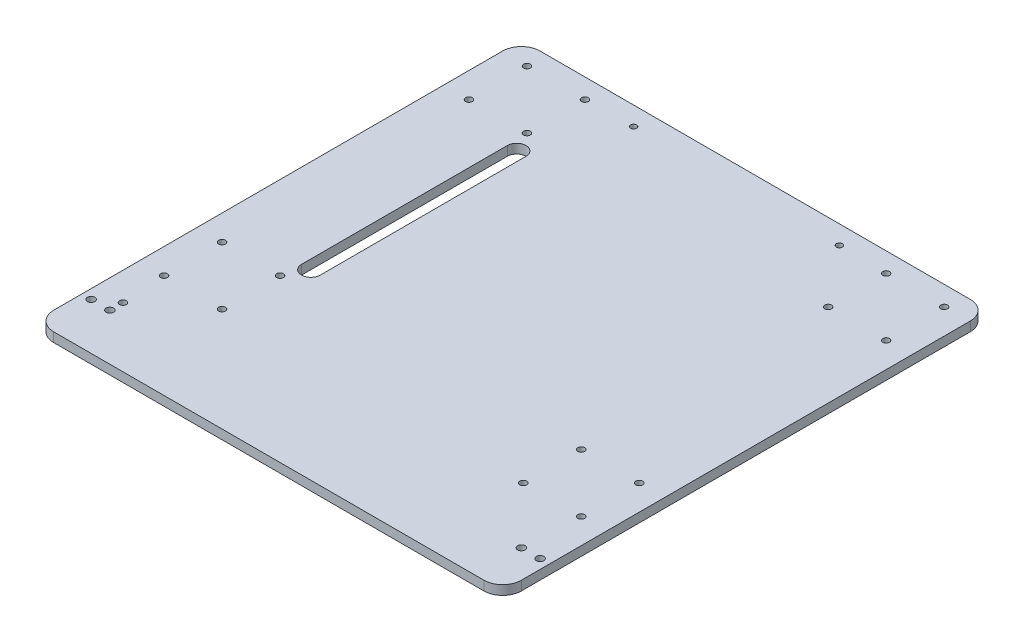
from build123d import *

# Parameters (mm, degrees)
SKETCH_1_W      = 250
SKETCH_1_H      = 260
SKETCH_1_R      = 1.8
SKETCH_1_R_2    = 2
SKETCH_1_R_3    = 1.6
EXTRUDE_1_DEPTH = 5
FILLET_2_R      = 10


with BuildPart() as part:
    # 草图1 → 凸台-拉伸1 (new body)
    with BuildSketch(Plane(origin=(0, 0, 0), x_dir=(1, 0, 0), z_dir=(0, 1, 0))):
        Rectangle(SKETCH_1_W, SKETCH_1_H)
        with Locations((-111.5, 119.5)):
            Circle(SKETCH_1_R, mode=Mode.SUBTRACT)
        with Locations((-80.5, 119.5)):
            Circle(SKETCH_1_R, mode=Mode.SUBTRACT)
        with Locations((-80.5, 88.5)):
            Circle(SKETCH_1_R, mode=Mode.SUBTRACT)
        with Locations((-111.5, 88.5)):
            Circle(SKETCH_1_R, mode=Mode.SUBTRACT)
        with Locations((-111.5, -43.5)):
            Circle(SKETCH_1_R, mode=Mode.SUBTRACT)
        with Locations((-80.5, -43.5)):
            Circle(SKETCH_1_R, mode=Mode.SUBTRACT)
        with Locations((-80.5, -74.5)):
            Circle(SKETCH_1_R, mode=Mode.SUBTRACT)
        with Locations((-111.5, -74.5)):
            Circle(SKETCH_1_R, mode=Mode.SUBTRACT)
        with Locations((111.5, -74.5)):
            Circle(SKETCH_1_R, mode=Mode.SUBTRACT)
        with Locations((80.5, -74.5)):
            Circle(SKETCH_1_R, mode=Mode.SUBTRACT)
        with Locations((80.5, -43.5)):
            Circle(SKETCH_1_R, mode=Mode.SUBTRACT)
        with Locations((111.5, -43.5)):
            Circle(SKETCH_1_R, mode=Mode.SUBTRACT)
        with Locations((111.5, 88.5)):
            Circle(SKETCH_1_R, mode=Mode.SUBTRACT)
        with Locations((80.5, 88.5)):
            Circle(SKETCH_1_R, mode=Mode.SUBTRACT)
        with Locations((80.5, 119.5)):
            Circle(SKETCH_1_R, mode=Mode.SUBTRACT)
        with Locations((111.5, 119.5)):
            Circle(SKETCH_1_R, mode=Mode.SUBTRACT)
        with Locations((-120, -105)):
            Circle(SKETCH_1_R_2, mode=Mode.SUBTRACT)
        with Locations((-110, -105)):
            Circle(SKETCH_1_R_2, mode=Mode.SUBTRACT)
        with Locations((110, -105)):
            Circle(SKETCH_1_R_2, mode=Mode.SUBTRACT)
        with Locations((120, -105)):
            Circle(SKETCH_1_R_2, mode=Mode.SUBTRACT)
        with Locations((-55, 120)):
            Circle(SKETCH_1_R_3, mode=Mode.SUBTRACT)
        with Locations((55, 120)):
            Circle(SKETCH_1_R_3, mode=Mode.SUBTRACT)
        with Locations((-110, -98)):
            Circle(SKETCH_1_R, mode=Mode.SUBTRACT)
        with BuildLine():
            Line((-70, 77.5), (-70, -32.5))
            ThreePointArc((-70, -32.5), (-75, -37.5), (-80, -32.5))
            Line((-80, -32.5), (-80, 77.5))
            ThreePointArc((-80, 77.5), (-75, 82.5), (-70, 77.5))
        make_face(mode=Mode.SUBTRACT)
    extrude(amount=EXTRUDE_1_DEPTH)

    # 圆角2
    fillet_2_edges = [part.edges().sort_by_distance(p)[0] for p in [
        (125, 2.5, -130),
        (125, 2.5, 130),
        (-125, 2.5, -130),
        (-125, 2.5, 130),
    ]]
    fillet(fillet_2_edges, radius=FILLET_2_R)


solid = part.part
